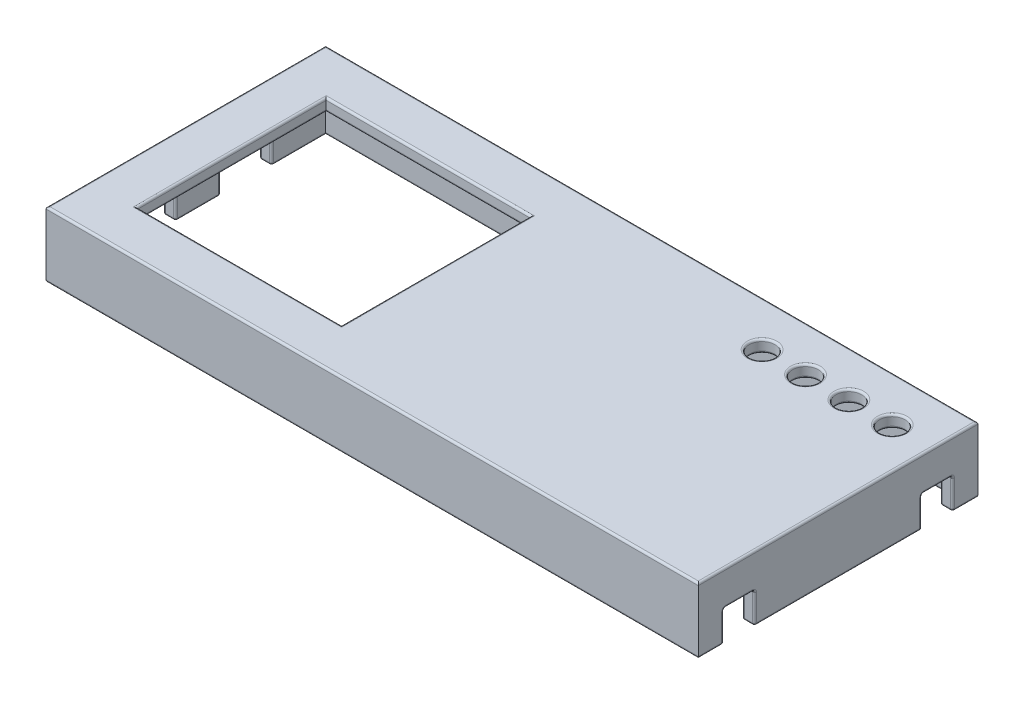
from build123d import *

# Parameters (mm, degrees)
SKETCH1_W           = 127.8
SKETCH1_H           = 54.8
SKETCH1_W_2         = 123
SKETCH1_H_2         = 50
BOSS_EXTRUDE1_DEPTH = 10.4
SKETCH2_W           = 127.8
SKETCH2_H           = 54.8
BOSS_EXTRUDE2_DEPTH = 2.4
SKETCH3_W           = 10
SKETCH3_H           = 5
CUT_EXTRUDE1_DEPTH  = 10
SKETCH4_W           = 40
SKETCH4_H           = 37
CUT_EXTRUDE2_DEPTH  = 10
SKETCH5_W           = 6
SKETCH5_H           = 6
CUT_EXTRUDE3_DEPTH  = 10
SKETCH6_W           = 15
SKETCH6_H           = 10
CUT_EXTRUDE4_DEPTH  = 10
SKETCH7_R           = 2.5
CUT_EXTRUDE5_DEPTH  = 10
FILLET1_R           = 0.4
FILLET2_R           = 0.4
FILLET3_R           = 0.4
FILLET4_R           = 0.4


with BuildPart() as part:
    # Sketch1 → Boss-Extrude1 (new body)
    with BuildSketch(Plane(origin=(0, 0, 0), x_dir=(1, 0, 0), z_dir=(0, 1, 0))):
        with Locations((61.5, -25)):
            Rectangle(SKETCH1_W, SKETCH1_H)
        with Locations((61.5, -25)):
            Rectangle(SKETCH1_W_2, SKETCH1_H_2, mode=Mode.SUBTRACT)
    extrude(amount=BOSS_EXTRUDE1_DEPTH)

    # Sketch2 → Boss-Extrude2 (add)
    with BuildSketch(Plane(origin=(0, 10.4, 0), x_dir=(1, 0, 0), z_dir=(0, 1, 0))):
        with Locations((61.5, -25)):
            Rectangle(SKETCH2_W, SKETCH2_H)
    extrude(amount=BOSS_EXTRUDE2_DEPTH)

    # Sketch3 → Cut-Extrude1 (cut)
    with BuildSketch(Plane.ZY.offset(2.4)):
        with Locations((15.6, 2.5)):
            Rectangle(SKETCH3_W, SKETCH3_H)
        with Locations((34.4, 2.5)):
            Rectangle(SKETCH3_W, SKETCH3_H)
    extrude(amount=-CUT_EXTRUDE1_DEPTH, mode=Mode.SUBTRACT)

    # Sketch4 → Cut-Extrude2 (cut)
    with BuildSketch(Plane(origin=(0, 12.8, 0), x_dir=(1, 0, 0), z_dir=(0, 1, 0))):
        with Locations((26.6, -25)):
            Rectangle(SKETCH4_W, SKETCH4_H)
    extrude(amount=-CUT_EXTRUDE2_DEPTH, mode=Mode.SUBTRACT)

    # Sketch5 → Cut-Extrude3 (cut)
    with BuildSketch(Plane(origin=(125.4, 0, 0), x_dir=(0, 0, -1), z_dir=(1, 0, 0))):
        with Locations((-5.6, 3)):
            Rectangle(SKETCH5_W, SKETCH5_H)
        with Locations((-44.4, 3)):
            Rectangle(SKETCH5_W, SKETCH5_H)
    extrude(amount=-CUT_EXTRUDE3_DEPTH, mode=Mode.SUBTRACT)

    # Sketch6 → Cut-Extrude4 (cut)
    with BuildSketch(Plane(origin=(0, 0, -2.4), x_dir=(-1, 0, 0), z_dir=(0, 0, -1))):
        with Locations((-71.9, 5)):
            Rectangle(SKETCH6_W, SKETCH6_H)
    extrude(amount=-CUT_EXTRUDE4_DEPTH, mode=Mode.SUBTRACT)

    # Sketch7 → Cut-Extrude5 (cut)
    with BuildSketch(Plane(origin=(0, 10.4, 0), x_dir=(-1, 0, 0), z_dir=(0, -1, 0))):
        with Locations(Location((-117.5, -6.5, 0), (0, 0, 90))):
            Circle(SKETCH7_R)
        with Locations(Location((-109, -6.5, 0), (0, 0, 90))):
            Circle(SKETCH7_R)
        with Locations(Location((-100.5, -6.5, 0), (0, 0, 90))):
            Circle(SKETCH7_R)
        with Locations(Location((-92, -6.5, 0), (0, 0, 90))):
            Circle(SKETCH7_R)
    extrude(amount=-CUT_EXTRUDE5_DEPTH, mode=Mode.SUBTRACT)

    # Fillet1
    fillet1_edges = [part.edges().sort_by_distance(p)[0] for p in [
        (117.5, 12.8, 9),
        (109, 12.8, 9),
        (100.5, 12.8, 9),
        (92, 12.8, 9),
        (-2.4, 12.8, 25),
        (61.5, 12.8, 52.4),
        (125.4, 12.8, 25),
        (61.5, 12.8, -2.4),
        (6.6, 12.8, 25),
        (26.6, 12.8, 43.5),
        (46.6, 12.8, 25),
        (26.6, 12.8, 6.5),
    ]]
    fillet(fillet1_edges, radius=FILLET1_R)

    # Fillet2
    fillet2_edges = [part.edges().sort_by_distance(p)[0] for p in [
        (123, 0, 25),
        (123, 0, 1.3),
        (123, 6, 44.4),
        (123, 3, 47.4),
        (123, 3, 41.4),
        (123, 3, 2.6),
        (123, 6, 5.6),
        (123, 3, 8.6),
        (125.4, 0, 25),
        (125.4, 0, 0.1),
        (124.2, 0, 8.6),
        (124.2, 6, 8.6),
        (124.2, 6, 2.6),
        (124.2, 0, 2.6),
        (125.4, 3, 8.6),
        (125.4, 3, 2.6),
        (125.4, 6, 5.6),
        (124.2, 6, 41.4),
        (124.2, 0, 41.4),
        (124.2, 0, 47.4),
        (124.2, 6, 47.4),
        (125.4, 3, 41.4),
        (125.4, 6, 44.4),
        (125.4, 3, 47.4),
        (32.2, 0, 0),
        (64.4, 5, 0),
        (71.9, 10, 0),
        (79.4, 5, 0),
        (31, 0, -2.4),
        (79.4, 0, -1.2),
        (79.4, 10, -1.2),
        (64.4, 10, -1.2),
        (64.4, 0, -1.2),
        (79.4, 5, -2.4),
        (64.4, 5, -2.4),
        (71.9, 10, -2.4),
        (0, 0, 5.3),
        (61.5, 0, 50),
        (123, 0, 48.7),
        (101.2, 0, 0),
        (0, 0, 25),
        (0, 0, 44.7),
        (0, 2.5, 39.4),
        (0, 5, 34.4),
        (0, 2.5, 29.4),
        (0, 2.5, 20.6),
        (0, 5, 15.6),
        (0, 2.5, 10.6),
        (-2.4, 0, 25),
        (-2.4, 0, 45.9),
        (125.4, 0, 49.9),
        (61.5, 0, 52.4),
        (-1.2, 0, 10.6),
        (-1.2, 5, 10.6),
        (-1.2, 5, 20.6),
        (-1.2, 0, 20.6),
        (-2.4, 2.5, 10.6),
        (-2.4, 2.5, 20.6),
        (-2.4, 5, 15.6),
        (-2.4, 0, 4.1),
        (102.4, 0, -2.4),
        (-1.2, 0, 29.4),
        (-1.2, 5, 29.4),
        (-1.2, 5, 39.4),
        (-1.2, 0, 39.4),
        (-2.4, 2.5, 29.4),
        (-2.4, 2.5, 39.4),
        (-2.4, 5, 34.4),
    ]]
    fillet(fillet2_edges, radius=FILLET2_R - 0.0001)  # a hair under: the kernel refuses the full size

    # Fillet3
    fillet3_edges = [part.edges().sort_by_distance(p)[0] for p in [
        (117.5, 10.4, 9),
        (109, 10.4, 9),
        (100.5, 10.4, 9),
        (92, 10.4, 9),
    ]]
    fillet(fillet3_edges, radius=FILLET3_R)

    # Fillet4
    fillet4_edges = [part.edges().sort_by_distance(p)[0] for p in [
        (6.6, 10.4, 25),
        (26.6, 10.4, 6.5),
        (46.6, 10.4, 25),
        (26.6, 10.4, 43.5),
    ]]
    fillet(fillet4_edges, radius=FILLET4_R)


solid = part.part
